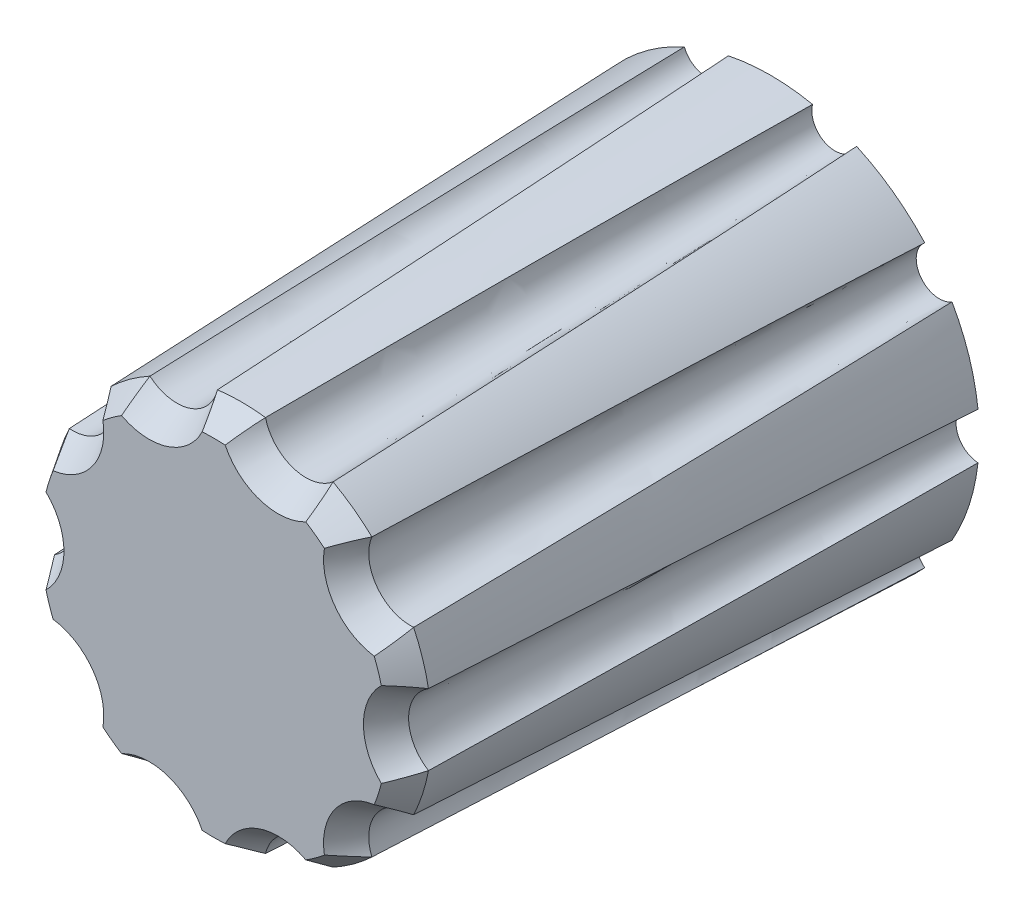
from build123d import *
from OCP.BRepFilletAPI import BRepFilletAPI_MakeChamfer

# Parameters (mm, degrees)
BOSS_EXTRU_1_DEPTH      = 12
BOSS_EXTRU_1_TAPER      = 2
CHANFREIN2_SIZE         = 0.6
CHANFREIN2_SIZE2        = 0.353753521
ENL_V_MAT_EXTRU_1_DEPTH = 10
ESQUISSE4_R             = 0.2
ENL_V_MAT_EXTRU_4_DEPTH = 10
CHANFREIN3_SIZE         = 0.2


with BuildPart() as part:
    # Esquisse1 → Boss.-Extru.1 (new body)
    with BuildSketch(Plane.XY):
        with BuildLine():
            ThreePointArc((4.472222222, -0.499227799), (4, 0), (4.472222222, 0.499227799))
            ThreePointArc((4.472222222, 0.499227799), (4.279754323, 1.390576475), (3.911542518, 2.224822494))
            ThreePointArc((3.911542518, 2.224822494), (3.236067977, 2.351141009), (3.324665043, 3.03259004))
            ThreePointArc((3.324665043, 3.03259004), (2.645033635, 3.640576475), (1.85678652, 4.099066213))
            ThreePointArc((1.85678652, 4.099066213), (1.236067977, 3.804226065), (0.907198818, 4.407605961))
            ThreePointArc((0.907198818, 4.407605961), (0, 4.5), (-0.907198818, 4.407605961))
            ThreePointArc((-0.907198818, 4.407605961), (-1.236067977, 3.804226065), (-1.85678652, 4.099066213))
            ThreePointArc((-1.85678652, 4.099066213), (-2.645033635, 3.640576475), (-3.324665043, 3.03259004))
            ThreePointArc((-3.324665043, 3.03259004), (-3.236067977, 2.351141009), (-3.911542518, 2.224822494))
            ThreePointArc((-3.911542518, 2.224822494), (-4.279754323, 1.390576475), (-4.472222222, 0.499227799))
            ThreePointArc((-4.472222222, 0.499227799), (-4, 0), (-4.472222222, -0.499227799))
            ThreePointArc((-4.472222222, -0.499227799), (-4.279754323, -1.390576475), (-3.911542518, -2.224822494))
            ThreePointArc((-3.911542518, -2.224822494), (-3.236067977, -2.351141009), (-3.324665043, -3.03259004))
            ThreePointArc((-3.324665043, -3.03259004), (-2.645033635, -3.640576475), (-1.85678652, -4.099066213))
            ThreePointArc((-1.85678652, -4.099066213), (-1.236067977, -3.804226065), (-0.907198818, -4.407605961))
            ThreePointArc((-0.907198818, -4.407605961), (0, -4.5), (0.907198818, -4.407605961))
            ThreePointArc((0.907198818, -4.407605961), (1.236067977, -3.804226065), (1.85678652, -4.099066213))
            ThreePointArc((1.85678652, -4.099066213), (2.645033635, -3.640576475), (3.324665043, -3.03259004))
            ThreePointArc((3.324665043, -3.03259004), (3.236067977, -2.351141009), (3.911542518, -2.224822494))
            ThreePointArc((3.911542518, -2.224822494), (4.279754323, -1.390576475), (4.472222222, -0.499227799))
        make_face()
    extrude(amount=BOSS_EXTRU_1_DEPTH, taper=BOSS_EXTRU_1_TAPER)

    # Chanfrein2: one chamfer whose edges measure the first distance from different faces: ONE call of the kernel's chamfer builder (chamfer() names one face for all edges)
    chanfrein2_edges_1 = [part.edges().sort_by_distance(p)[0] for p in [
        (-3.881214819, 1.26108314, 12),
    ]]
    chanfrein2_side_1 = [part.faces().sort_by_distance(p)[0] for p in [
        (-4.080484571, 1.325829807, 6),
    ]]
    chanfrein2_edges_2 = [part.edges().sort_by_distance(p)[0] for p in [
        (-2.897050026, 2.104830049, 12),
    ]]
    chanfrein2_side_2 = [part.faces().sort_by_distance(p)[0] for p in [
        (-3.066559002, 2.227985529, 6),
    ]]
    chanfrein2_edges_3 = [part.edges().sort_by_distance(p)[0] for p in [
        (-2.398722676, 3.301558523, 12),
    ]]
    chanfrein2_side_3 = [part.faces().sort_by_distance(p)[0] for p in [
        (-2.521878155, 3.471067499, 6),
    ]]
    chanfrein2_edges_4 = [part.edges().sort_by_distance(p)[0] for p in [
        (-1.106574643, 3.405686561, 12),
    ]]
    chanfrein2_side_4 = [part.faces().sort_by_distance(p)[0] for p in [
        (-1.17132131, 3.604956313, 6),
    ]]
    chanfrein2_edges_5 = [part.edges().sort_by_distance(p)[0] for p in [
        (0, 4.080950766, 12),
    ]]
    chanfrein2_side_5 = [part.faces().sort_by_distance(p)[0] for p in [
        (0, 4.290475383, 6),
    ]]
    chanfrein2_edges_6 = [part.edges().sort_by_distance(p)[0] for p in [
        (1.106574643, 3.405686561, 12),
    ]]
    chanfrein2_side_6 = [part.faces().sort_by_distance(p)[0] for p in [
        (1.17132131, 3.604956313, 6),
    ]]
    chanfrein2_edges_7 = [part.edges().sort_by_distance(p)[0] for p in [
        (2.398722676, 3.301558523, 12),
    ]]
    chanfrein2_side_7 = [part.faces().sort_by_distance(p)[0] for p in [
        (2.521878155, 3.471067499, 6),
    ]]
    chanfrein2_edges_8 = [part.edges().sort_by_distance(p)[0] for p in [
        (2.897050026, 2.104830049, 12),
    ]]
    chanfrein2_side_8 = [part.faces().sort_by_distance(p)[0] for p in [
        (3.066559002, 2.227985529, 6),
    ]]
    chanfrein2_edges_9 = [part.edges().sort_by_distance(p)[0] for p in [
        (3.881214819, 1.26108314, 12),
    ]]
    chanfrein2_side_9 = [part.faces().sort_by_distance(p)[0] for p in [
        (4.080484571, 1.325829807, 6),
    ]]
    chanfrein2_edges_10 = [part.edges().sort_by_distance(p)[0] for p in [
        (3.580950766, 0, 12),
    ]]
    chanfrein2_side_10 = [part.faces().sort_by_distance(p)[0] for p in [
        (3.790475383, 0, 6),
    ]]
    chanfrein2_edges_11 = [part.edges().sort_by_distance(p)[0] for p in [
        (3.881214819, -1.26108314, 12),
    ]]
    chanfrein2_side_11 = [part.faces().sort_by_distance(p)[0] for p in [
        (4.080484571, -1.325829807, 6),
    ]]
    chanfrein2_edges_12 = [part.edges().sort_by_distance(p)[0] for p in [
        (2.897050026, -2.104830049, 12),
    ]]
    chanfrein2_side_12 = [part.faces().sort_by_distance(p)[0] for p in [
        (3.066559002, -2.227985529, 6),
    ]]
    chanfrein2_edges_13 = [part.edges().sort_by_distance(p)[0] for p in [
        (2.398722676, -3.301558523, 12),
    ]]
    chanfrein2_side_13 = [part.faces().sort_by_distance(p)[0] for p in [
        (2.521878155, -3.471067499, 6),
    ]]
    chanfrein2_edges_14 = [part.edges().sort_by_distance(p)[0] for p in [
        (1.106574643, -3.405686561, 12),
    ]]
    chanfrein2_side_14 = [part.faces().sort_by_distance(p)[0] for p in [
        (1.17132131, -3.604956313, 6),
    ]]
    chanfrein2_edges_15 = [part.edges().sort_by_distance(p)[0] for p in [
        (0, -4.080950766, 12),
    ]]
    chanfrein2_side_15 = [part.faces().sort_by_distance(p)[0] for p in [
        (0, -4.290475383, 6),
    ]]
    chanfrein2_edges_16 = [part.edges().sort_by_distance(p)[0] for p in [
        (-1.106574643, -3.405686561, 12),
    ]]
    chanfrein2_side_16 = [part.faces().sort_by_distance(p)[0] for p in [
        (-1.17132131, -3.604956313, 6),
    ]]
    chanfrein2_edges_17 = [part.edges().sort_by_distance(p)[0] for p in [
        (-2.398722676, -3.301558523, 12),
    ]]
    chanfrein2_side_17 = [part.faces().sort_by_distance(p)[0] for p in [
        (-2.521878155, -3.471067499, 6),
    ]]
    chanfrein2_edges_18 = [part.edges().sort_by_distance(p)[0] for p in [
        (-2.897050026, -2.104830049, 12),
    ]]
    chanfrein2_side_18 = [part.faces().sort_by_distance(p)[0] for p in [
        (-3.066559002, -2.227985529, 6),
    ]]
    chanfrein2_edges_19 = [part.edges().sort_by_distance(p)[0] for p in [
        (-3.881214819, -1.26108314, 12),
    ]]
    chanfrein2_side_19 = [part.faces().sort_by_distance(p)[0] for p in [
        (-4.080484571, -1.325829807, 6),
    ]]
    chanfrein2_edges_20 = [part.edges().sort_by_distance(p)[0] for p in [
        (-3.580950766, 0, 12),
    ]]
    chanfrein2_side_20 = [part.faces().sort_by_distance(p)[0] for p in [
        (-3.790475383, 0, 6),
    ]]
    chanfrein2 = BRepFilletAPI_MakeChamfer(part.part.solid().wrapped)
    for e in chanfrein2_edges_1:
        chanfrein2.Add(CHANFREIN2_SIZE, CHANFREIN2_SIZE2, e.wrapped, chanfrein2_side_1[0].wrapped)  # the first distance lies on this face
    for e in chanfrein2_edges_2:
        chanfrein2.Add(CHANFREIN2_SIZE, CHANFREIN2_SIZE2, e.wrapped, chanfrein2_side_2[0].wrapped)  # the first distance lies on this face
    for e in chanfrein2_edges_3:
        chanfrein2.Add(CHANFREIN2_SIZE, CHANFREIN2_SIZE2, e.wrapped, chanfrein2_side_3[0].wrapped)  # the first distance lies on this face
    for e in chanfrein2_edges_4:
        chanfrein2.Add(CHANFREIN2_SIZE, CHANFREIN2_SIZE2, e.wrapped, chanfrein2_side_4[0].wrapped)  # the first distance lies on this face
    for e in chanfrein2_edges_5:
        chanfrein2.Add(CHANFREIN2_SIZE, CHANFREIN2_SIZE2, e.wrapped, chanfrein2_side_5[0].wrapped)  # the first distance lies on this face
    for e in chanfrein2_edges_6:
        chanfrein2.Add(CHANFREIN2_SIZE, CHANFREIN2_SIZE2, e.wrapped, chanfrein2_side_6[0].wrapped)  # the first distance lies on this face
    for e in chanfrein2_edges_7:
        chanfrein2.Add(CHANFREIN2_SIZE, CHANFREIN2_SIZE2, e.wrapped, chanfrein2_side_7[0].wrapped)  # the first distance lies on this face
    for e in chanfrein2_edges_8:
        chanfrein2.Add(CHANFREIN2_SIZE, CHANFREIN2_SIZE2, e.wrapped, chanfrein2_side_8[0].wrapped)  # the first distance lies on this face
    for e in chanfrein2_edges_9:
        chanfrein2.Add(CHANFREIN2_SIZE, CHANFREIN2_SIZE2, e.wrapped, chanfrein2_side_9[0].wrapped)  # the first distance lies on this face
    for e in chanfrein2_edges_10:
        chanfrein2.Add(CHANFREIN2_SIZE, CHANFREIN2_SIZE2, e.wrapped, chanfrein2_side_10[0].wrapped)  # the first distance lies on this face
    for e in chanfrein2_edges_11:
        chanfrein2.Add(CHANFREIN2_SIZE, CHANFREIN2_SIZE2, e.wrapped, chanfrein2_side_11[0].wrapped)  # the first distance lies on this face
    for e in chanfrein2_edges_12:
        chanfrein2.Add(CHANFREIN2_SIZE, CHANFREIN2_SIZE2, e.wrapped, chanfrein2_side_12[0].wrapped)  # the first distance lies on this face
    for e in chanfrein2_edges_13:
        chanfrein2.Add(CHANFREIN2_SIZE, CHANFREIN2_SIZE2, e.wrapped, chanfrein2_side_13[0].wrapped)  # the first distance lies on this face
    for e in chanfrein2_edges_14:
        chanfrein2.Add(CHANFREIN2_SIZE, CHANFREIN2_SIZE2, e.wrapped, chanfrein2_side_14[0].wrapped)  # the first distance lies on this face
    for e in chanfrein2_edges_15:
        chanfrein2.Add(CHANFREIN2_SIZE, CHANFREIN2_SIZE2, e.wrapped, chanfrein2_side_15[0].wrapped)  # the first distance lies on this face
    for e in chanfrein2_edges_16:
        chanfrein2.Add(CHANFREIN2_SIZE, CHANFREIN2_SIZE2, e.wrapped, chanfrein2_side_16[0].wrapped)  # the first distance lies on this face
    for e in chanfrein2_edges_17:
        chanfrein2.Add(CHANFREIN2_SIZE, CHANFREIN2_SIZE2, e.wrapped, chanfrein2_side_17[0].wrapped)  # the first distance lies on this face
    for e in chanfrein2_edges_18:
        chanfrein2.Add(CHANFREIN2_SIZE, CHANFREIN2_SIZE2, e.wrapped, chanfrein2_side_18[0].wrapped)  # the first distance lies on this face
    for e in chanfrein2_edges_19:
        chanfrein2.Add(CHANFREIN2_SIZE, CHANFREIN2_SIZE2, e.wrapped, chanfrein2_side_19[0].wrapped)  # the first distance lies on this face
    for e in chanfrein2_edges_20:
        chanfrein2.Add(CHANFREIN2_SIZE, CHANFREIN2_SIZE2, e.wrapped, chanfrein2_side_20[0].wrapped)  # the first distance lies on this face
    add(Compound.cast(chanfrein2.Shape()), mode=Mode.REPLACE)

    # Esquisse2 → Enlèv. mat.-Extru.1 (cut)
    with BuildSketch(Plane(origin=(0, 0, 0), x_dir=(-1, 0, 0), z_dir=(0, 0, -1))):
        with BuildLine():
            Line((-2.655183609, -1.6), (2.655183609, -1.6))
            ThreePointArc((2.655183609, -1.6), (2.986726401, -0.830340536), (3.1, 0))
            ThreePointArc((3.1, 0), (-0.830340536, 2.986726401), (-2.655183609, -1.6))
        make_face()
    extrude(amount=-ENL_V_MAT_EXTRU_1_DEPTH, mode=Mode.SUBTRACT)

    # Esquisse4 → Enlèv. mat.-Extru.4 (cut)
    with BuildSketch(Plane(origin=(0, 0, 0), x_dir=(-1, 0, 0), z_dir=(0, 0, -1))):
        with Locations((-2.655183609, -1.6)):
            Circle(ESQUISSE4_R)
        with Locations((2.598076211, -1.6)):
            Circle(ESQUISSE4_R)
    extrude(amount=-ENL_V_MAT_EXTRU_4_DEPTH, mode=Mode.SUBTRACT)

    # Chanfrein3
    chanfrein3_edges = [part.edges().sort_by_distance(p)[0] for p in [
        (0.028553699, -1.6, 0),
    ]]
    chamfer(chanfrein3_edges, length=CHANFREIN3_SIZE - 0.0001)  # a hair under: the kernel refuses the full size


solid = part.part
